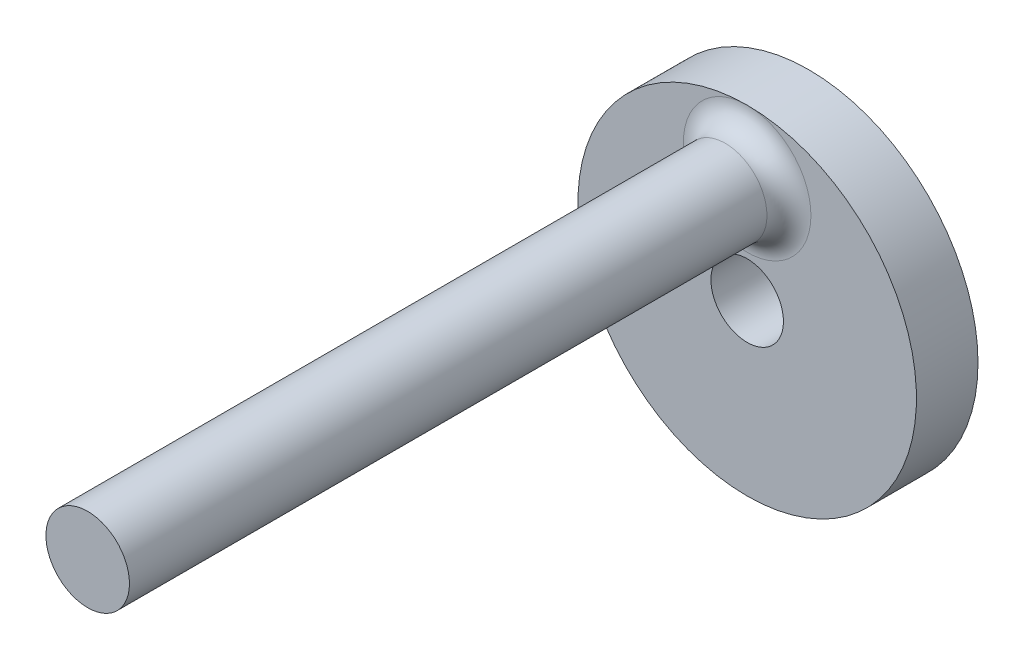
from build123d import *

# Parameters (mm, degrees)
ESQUISSE1_R             = 7.7
BOSS_EXTRU_1_DEPTH      = 2.8
ESQUISSE2_R             = 1.9
BOSS_EXTRU_2_DEPTH      = 30
ESQUISSE3_R             = 1.65
ENL_V_MAT_EXTRU_1_DEPTH = 32.91520014
CONG_2_R                = 1


with BuildPart() as part:
    # Esquisse1 → Boss.-Extru.1 (new body)
    with BuildSketch(Plane.XY):
        Circle(ESQUISSE1_R)
    extrude(amount=BOSS_EXTRU_1_DEPTH)

    # Esquisse2 → Boss.-Extru.2 (add)
    with BuildSketch(Plane.XY.offset(2.8)):
        with Locations((0, 4.8)):
            Circle(ESQUISSE2_R)
    extrude(amount=BOSS_EXTRU_2_DEPTH)

    # Esquisse3 → Enlèv. mat.-Extru.1 (cut, through all)
    with BuildSketch(Plane.XY.offset(2.8)):
        Circle(ESQUISSE3_R)
    extrude(amount=-ENL_V_MAT_EXTRU_1_DEPTH, mode=Mode.SUBTRACT)

    # Congé2
    cong_2_edges = [part.edges().sort_by_distance(p)[0] for p in [
        (-1.9, 4.8, 2.8),
    ]]
    fillet(cong_2_edges, radius=CONG_2_R - 0.0001)  # a hair under: the kernel refuses the full size


solid = part.part
